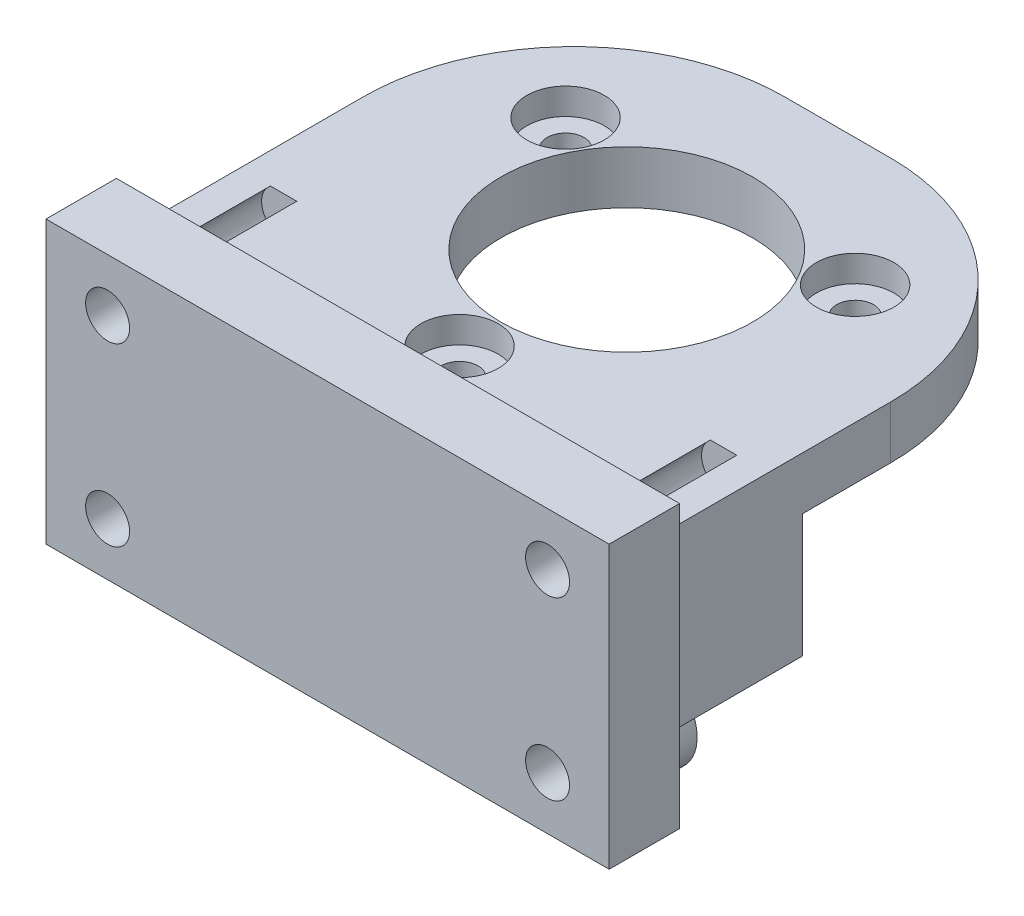
from build123d import *

# Parameters (mm, degrees)
SKETCH1_W                = 30
SKETCH1_H                = 10
MAIN_DEPTH               = 25
SKETCH5_R                = 1.05
SKETCH5_R_2              = 7.15
MAINANDFIXHOLE_DEPTH     = 31.822070015
SKETCH6_R                = 2.2
CODERFIXHOLE2_DEPTH      = 1.5
CODERHOLE2_DEPTH         = 7
SKETCH10_W               = 32
SKETCH10_H               = 16
LINK_DEPTH               = 4
SKETCH8_R                = 1.25
VERTICALHOLES_DEPTH      = 10
HOLELPATTERN1_COUNT      = 2
HOLELPATTERN1_PITCH      = 25
HOLELPATTERN1_COUNT_DIR2 = 2
HOLELPATTERN1_PITCH_DIR2 = 10
SKETCH13_R               = 2.5
LINKREINFORCEMENT_DEPTH  = 2
FILLET6_R                = 12


with BuildPart() as part:
    # Sketch1 → Main (new body)
    with BuildSketch(Plane.XY):
        Rectangle(SKETCH1_W, SKETCH1_H)
    extrude(amount=MAIN_DEPTH)

    # Sketch5 → MainAndFixHole (cut, through all)
    with BuildSketch(Plane(origin=(0, -5, 0), x_dir=(-1, 0, 0), z_dir=(0, -1, 0))):
        with Locations((0, -21.5)):
            Circle(SKETCH5_R)
        with Locations((-8.227241336, -7.25)):
            Circle(SKETCH5_R)
        with Locations((8.227241336, -7.25)):
            Circle(SKETCH5_R)
        with Locations((0, -12)):
            Circle(SKETCH5_R_2)
    extrude(amount=-MAINANDFIXHOLE_DEPTH, mode=Mode.SUBTRACT)

    # Sketch6 → CoderFixHole2 (cut)
    with BuildSketch(Plane(origin=(0, 5, 0), x_dir=(-1, 0, 0), z_dir=(0, -1, 0))):
        with Locations((0, -21.5)):
            Circle(SKETCH6_R)
        with Locations((-8.227241336, -7.25)):
            Circle(SKETCH6_R)
        with Locations((8.227241336, -7.25)):
            Circle(SKETCH6_R)
    extrude(amount=CODERFIXHOLE2_DEPTH, mode=Mode.SUBTRACT)

    # Sketch11 → CoderHole2 (cut)
    with BuildSketch(Plane(origin=(0, -5, 0), x_dir=(1, 0, 0), z_dir=(0, 1, 0))):
        with BuildLine():
            Line((-15, 0), (15, 0))
            Line((15, 0), (15, -17))
            Line((15, -17), (10.908712115, -17))
            ThreePointArc((10.908712115, -17), (0, -24), (-10.908712115, -17))
            Line((-10.908712115, -17), (-15, -17))
            Line((-15, -17), (-15, 0))
        make_face()
    extrude(amount=CODERHOLE2_DEPTH, mode=Mode.SUBTRACT)

    # Sketch10 → Link (add)
    with BuildSketch(Plane.XY.offset(25)):
        with Locations((0, -1)):
            Rectangle(SKETCH10_W, SKETCH10_H)
    extrude(amount=LINK_DEPTH)

    # Sketch8 → VerticalHoles (cut)
    with BuildSketch(Plane.XY.offset(29)):
        with Locations((12.5, 4)):
            Circle(SKETCH8_R)
    verticalholes = extrude(amount=-VERTICALHOLES_DEPTH, mode=Mode.SUBTRACT)

    # HoleLPattern1: VerticalHoles 2 × 2
    with Locations(*[(-i * HOLELPATTERN1_PITCH, -j * HOLELPATTERN1_PITCH_DIR2, 0) for i in range(HOLELPATTERN1_COUNT) for j in range(HOLELPATTERN1_COUNT_DIR2) if (i, j) != (0, 0)]):
        add(verticalholes, mode=Mode.SUBTRACT)

    # Sketch13 → LinkReinforcement (add)
    with BuildSketch(Plane(origin=(0, 0, 25), x_dir=(-1, 0, 0), z_dir=(0, 0, -1))):
        with Locations((-12.5, -6)):
            Circle(SKETCH13_R)
        with Locations((12.5, -6)):
            Circle(SKETCH13_R)
    extrude(amount=LINKREINFORCEMENT_DEPTH)

    # Fillet6
    fillet6_edges = [part.edges().sort_by_distance(p)[0] for p in [
        (15, 3.5, 0),
        (-15, 3.5, 0),
    ]]
    fillet(fillet6_edges, radius=FILLET6_R)


solid = part.part
